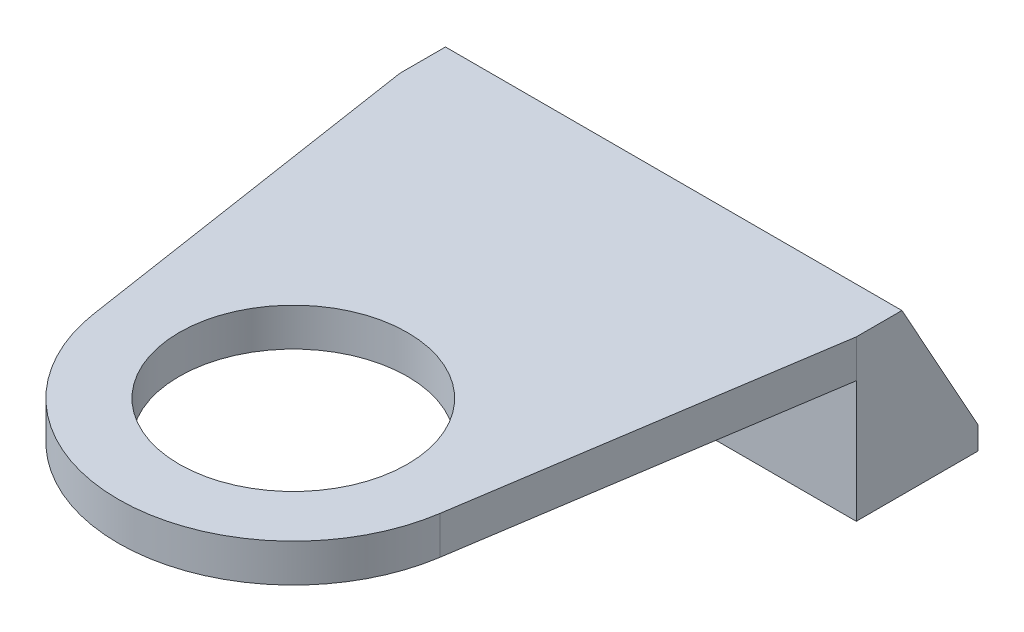
from build123d import *

# Parameters (mm, degrees)
SKETCH_1_W          = 60
SKETCH_1_H          = 16
EXTRUDE_1_DEPTH     = 3
SKETCH_2_W          = 60
SKETCH_2_H          = 6
EXTRUDE_2_DEPTH     = 18
SKETCH_3_W          = 60
SKETCH_3_H          = 5
EXTRUDE_3_DEPTH     = 100
RIB_1_REACH         = 116.039
SKETCH_4_WALL_W     = 250.670193986
SKETCH_4_WALL_H     = 10
EXTRUDE_4_DEPTH     = 6
CUT_EXTRUDE_1_DEPTH = 115.039466852
SKETCH_8_3_R        = 15
CUT_EXTRUDE_2_DEPTH = 84.462566459


# Read off the part's stored shape, not the designer's step: 高级异型孔1
with BuildPart() as part:
    # 草图1 → 凸台-拉伸1 (new body)
    with BuildSketch(Plane(origin=(0, 0, 0), x_dir=(1, 0, 0), z_dir=(0, 1, 0))):
        Rectangle(SKETCH_1_W, SKETCH_1_H)
    extrude(amount=EXTRUDE_1_DEPTH)

    # 草图2 → 凸台-拉伸2 (add)
    with BuildSketch(Plane(origin=(0, 3, 0), x_dir=(1, 0, 0), z_dir=(0, 1, 0))):
        with Locations((0, -5)):
            Rectangle(SKETCH_2_W, SKETCH_2_H)
    extrude(amount=EXTRUDE_2_DEPTH)

    # 草图3 → 凸台-拉伸3 (add)
    with BuildSketch(Plane.XY.offset(8)):
        with Locations((0, 18.5)):
            Rectangle(SKETCH_3_W, SKETCH_3_H)
    extrude(amount=EXTRUDE_3_DEPTH)

    # 草图4 wall → 筋1 (add, up to next)
    with BuildSketch(Plane(origin=(0, 12, -3), x_dir=(0, -0.874157276122, -0.485642931179), z_dir=(0, 0.485642931179, -0.874157276122)), mode=Mode.PRIVATE) as rib_1_sk1:
        Rectangle(SKETCH_4_WALL_W, SKETCH_4_WALL_H)
    rib_1_tool1 = extrude(rib_1_sk1.sketch, amount=-RIB_1_REACH, mode=Mode.PRIVATE) - part.part
    add(rib_1_tool1.solids().sort_by_distance((0, 12, -3))[0])

    # 草图5 → 凸台-拉伸4 (add)
    with BuildSketch(Plane(origin=(30, 0, 0), x_dir=(0, 0, -1), z_dir=(1, 0, 0))):
        Polygon((-2, 21), (8, 3), (-2, 3), align=None)
    extrude_4 = extrude(amount=-EXTRUDE_4_DEPTH)

    # 镜向1: 凸台-拉伸4 across plane
    add(extrude_4.mirror(Plane(origin=(0, 0, 0), x_dir=(0, 0, 1), z_dir=(1, 0, 0))))

    # 高级异型孔1 outline → 高级异型孔1 (revolve, cut)
    with BuildSketch(Plane(origin=(-15, 0, -3), x_dir=(1, 0, 0), z_dir=(0, 0, 1))):
        Polygon((3.3, 3), (0, 3), (0, 0), (1.6, 0), (1.6, 1.3), align=None)
    other_1 = revolve(axis=Axis((-15, 0, -3), (0, 1, 0)), mode=Mode.SUBTRACT)

    # 镜向2: 高级异型孔1 across plane
    add(other_1.mirror(Plane(origin=(0, 0, 0), x_dir=(0, 0, 1), z_dir=(1, 0, 0))), mode=Mode.SUBTRACT)

    # 草图8 → 切除-拉伸1 (cut, through all)
    with BuildSketch(Plane(origin=(0, 21, 0), x_dir=(1, 0, 0), z_dir=(0, 1, 0))):
        with BuildLine():
            Line((-22.735407162, -55.478686702), (-30, -8))
            Line((-30, -8), (-30, -108))
            Line((-30, -108), (30, -108))
            Line((30, -108), (30, -8))
            Line((30, -8), (22.735407162, -55.478686702))
            ThreePointArc((22.735407162, -55.478686702), (0, -75), (-22.735407162, -55.478686702))
        make_face()
    extrude(amount=-CUT_EXTRUDE_1_DEPTH, mode=Mode.SUBTRACT)

    # 草图8<3> → 切除-拉伸2 (cut, through all)
    with BuildSketch(Plane(origin=(0, 21, 0), x_dir=(1, 0, 0), z_dir=(0, 1, 0))):
        with Locations(Location((0, -52, 0), (0, 0, 270))):
            Circle(SKETCH_8_3_R)
    extrude(amount=-CUT_EXTRUDE_2_DEPTH, mode=Mode.SUBTRACT)


solid = part.part
